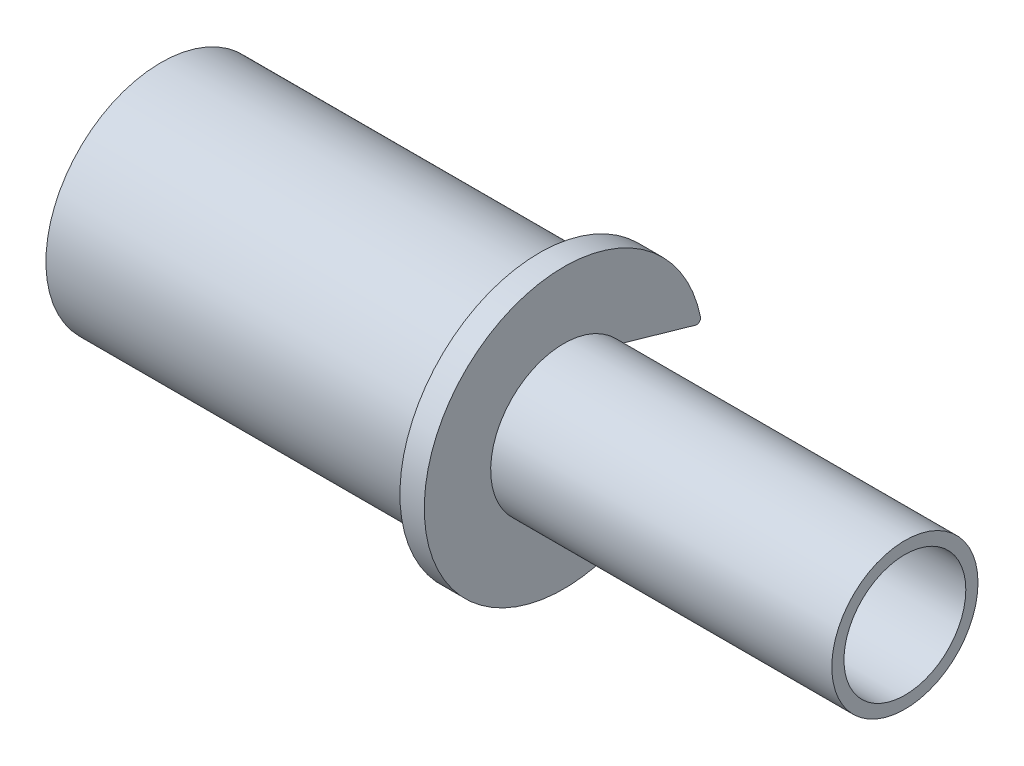
from build123d import *

# Parameters (mm, degrees)
CUT_EXTRUDE2_REACH = 55.64
FILLET1_R          = 0.254


with BuildPart() as part:
    # Sketch1 → Revolve1 (revolve)
    with BuildSketch(Plane.XY):
        Polygon((-3.615625, 3.96875), (-3.615625, 4.7625), (-25.840625, 4.7625), (-25.840625, 9.087499986), (-27.428125, 9.087499986), (-27.428125, 7.499999986), (-52.078124952, 7.499999986), (-52.078124952, 3.96875), align=None)
    revolve(axis=Axis((0, 0, 0), (-1, 0, 0)))

    # Sketch3 → Cut-Extrude2 (cut, up to next)
    with BuildSketch(Plane(origin=(0, 0, 0), x_dir=(1, 0, 0), z_dir=(0, 0.27562111199769546, 0.9612663536300197)), mode=Mode.PRIVATE) as cut_extrude2_sk1:
        with BuildLine():
            Line((-39.378124952, 1.42875), (-39.378124952, -1.42875))
            ThreePointArc((-39.378124952, -1.42875), (-38.680672975, -3.112548023), (-36.996874952, -3.81))
            Line((-36.996874952, -3.81), (-25.840625, -3.81))
            ThreePointArc((-25.840625, -3.81), (-23.59556097, -2.88006403), (-22.665625, -0.635))
            Line((-22.665625, -0.635), (-22.665625, 0.635))
            ThreePointArc((-22.665625, 0.635), (-23.59556097, 2.88006403), (-25.840625, 3.81))
            Line((-25.840625, 3.81), (-36.996874952, 3.81))
            ThreePointArc((-36.996874952, 3.81), (-38.680672975, 3.112548023), (-39.378124952, 1.42875))
        make_face()
    cut_extrude2_tool1 = extrude(cut_extrude2_sk1.sketch, amount=-CUT_EXTRUDE2_REACH, mode=Mode.PRIVATE) & part.part
    # Sketch3 → Cut-Extrude2 (cut, up to next)
    with BuildSketch(Plane(origin=(0, 0, 0), x_dir=(1, 0, 0), z_dir=(0, 0.27562111199769546, 0.9612663536300197)), mode=Mode.PRIVATE) as cut_extrude2_sk2:
        with BuildLine():
            Line((-52.078124952, 3.81), (-52.078124952, -3.81))
            Line((-52.078124952, -3.81), (-48.903124952, -3.81))
            ThreePointArc((-48.903124952, -3.81), (-47.780592937, -3.345032015), (-47.315624952, -2.2225))
            Line((-47.315624952, -2.2225), (-47.315624952, 2.2225))
            ThreePointArc((-47.315624952, 2.2225), (-47.780592937, 3.345032015), (-48.903124952, 3.81))
            Line((-48.903124952, 3.81), (-52.078124952, 3.81))
        make_face()
    cut_extrude2_tool2 = extrude(cut_extrude2_sk2.sketch, amount=-CUT_EXTRUDE2_REACH, mode=Mode.PRIVATE) & part.part
    add(cut_extrude2_tool1.solids().sort_by_distance((-31.138334, 0, 0))[0], mode=Mode.SUBTRACT)
    add(cut_extrude2_tool2.solids().sort_by_distance((-49.759137, 0, 0))[0], mode=Mode.SUBTRACT)

    # Fillet1
    fillet1_edges = [part.edges().sort_by_distance(p)[0] for p in [
        (-26.634375, 1.388482882, -8.980800147),
        (-26.634375, -5.936366733, -6.880567274),
        (-32.212499976, -5.442986251, -5.159835313),
        (-32.212499976, 1.881863363, -7.260068186),
        (-38.692149325, -4.863068514, -5.709690367),
        (-39.378124952, -2.067158336, -7.209497639),
        (-38.692149329, 1.098691827, -7.419088627),
        (-50.490624952, 1.881863363, -7.260068186),
        (-47.764947055, 1.34787101, -7.377888813),
        (-47.315624952, -2.067158336, -7.209497639),
        (-47.764947066, -5.052557531, -5.542712524),
        (-50.490624952, -5.442986251, -5.159835313),
    ]]
    fillet(fillet1_edges, radius=FILLET1_R)


solid = part.part
